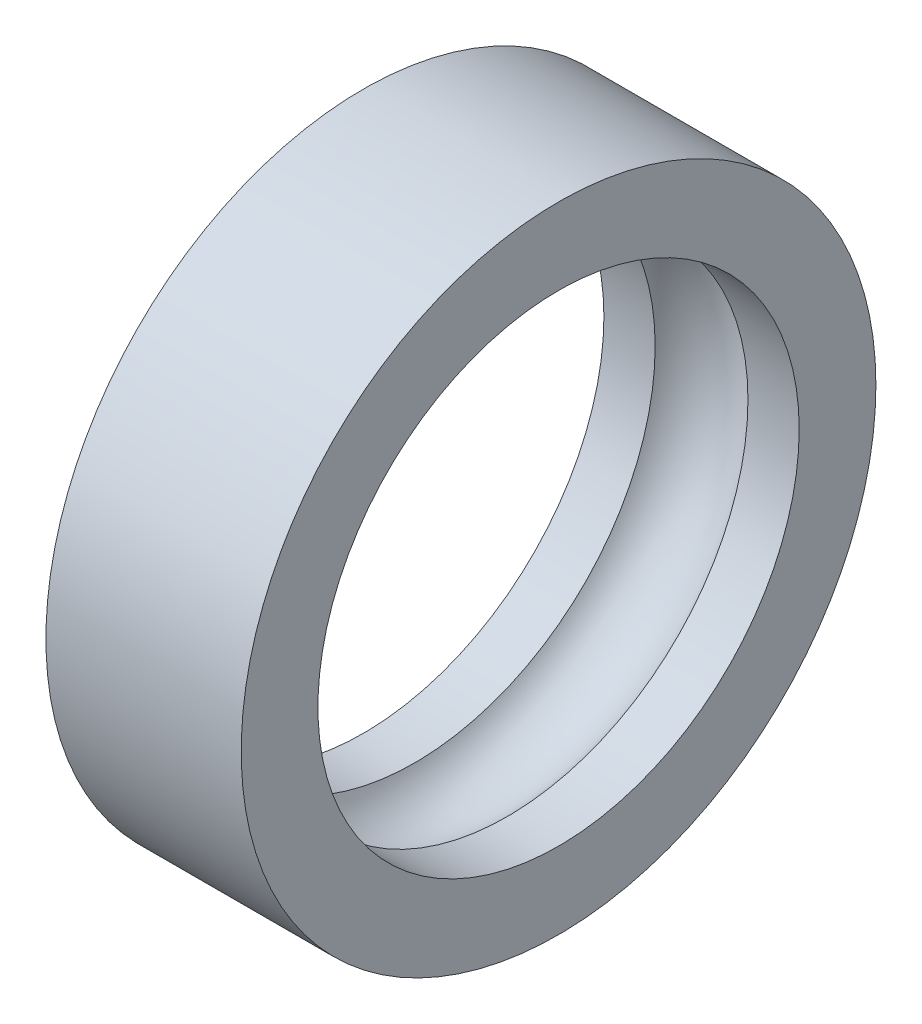
from build123d import *

# Parameters (mm, degrees)
SCALE2_SCALE = 6
SCALE3_SCALE = 3.323882225
SCALE4_SCALE = 0.416652997
SCALE5_SCALE = 0.70539227
SCALE6_SCALE = 0.666666667


with BuildPart() as part:
    # Sketch1 → Revolve1 (revolve)
    with BuildSketch(Plane.XY):
        with BuildLine():
            Line((0, 4.25), (4, 4.25))
            Line((4, 4.25), (4, 1.108))
            Line((4, 1.108), (1.900614637, 1.108))
            ThreePointArc((1.900614637, 1.108), (0, 2.2), (-1.900614637, 1.108))
            Line((-1.900614637, 1.108), (-4, 1.108))
            Line((-4, 1.108), (-4, 4.25))
            Line((-4, 4.25), (0, 4.25))
        make_face()
    revolve(axis=Axis((4, -8.75, 0), (-1, 0, 0)))


with BuildPart() as part_1:
    # Scale2: scaled about (0, -8.75, 0)
    add(part.part.scale(SCALE2_SCALE).moved(Location((0, 43.75, 0))))


with BuildPart() as part_2:
    # Scale3: scaled about (0, -8.75, 0)
    add(part_1.part.scale(SCALE3_SCALE).moved(Location((0, 20.333969466, 0))))


with BuildPart() as part_3:
    # Scale4: scaled about (0, -8.75, 0)
    add(part_2.part.scale(SCALE4_SCALE).moved(Location((0, -5.104286277, 0))))


with BuildPart() as part_4:
    # Scale5: scaled about (0, -8.75, 0)
    add(part_3.part.scale(SCALE5_SCALE).moved(Location((0, -2.577817635, 0))))


with BuildPart() as part_5:
    # Scale6: scaled about (0, -8.75, 0)
    add(part_4.part.scale(SCALE6_SCALE).moved(Location((0, -2.916666667, 0))))


solid = part_5.part
